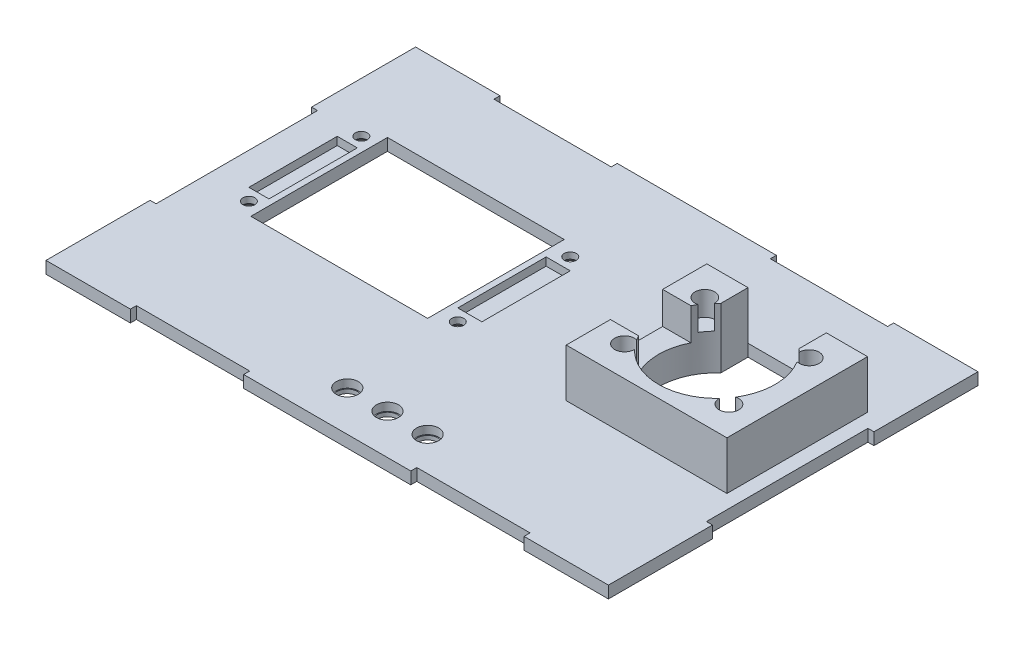
from build123d import *

# Parameters (mm, degrees)
SKETCH1_W                   = 140
SKETCH1_H                   = 92
SKETCH1_R                   = 2.5
SKETCH1_R_2                 = 1.5
SKETCH1_W_2                 = 44
SKETCH1_H_2                 = 34
BOSS_EXTRUDE2_DEPTH         = 3
SKETCH3_W                   = 40
SKETCH3_H                   = 35
SKETCH3_R                   = 14.5
BOSS_EXTRUDE3_DEPTH         = 12
SKETCH5_R                   = 2.45
CUT_EXTRUDE1_DEPTH          = 6
SKETCH6_W                   = 9
SKETCH6_H                   = 13
CUT_EXTRUDE3_DEPTH          = 8
SKETCH8_W                   = 29.2
SKETCH8_H                   = 1.5
SKETCH8_W_2                 = 1.5
SKETCH8_H_2                 = 40.2
SKETCH8_W_3                 = 28.2
CUT_EXTRUDE4_DEPTH          = 107.976632963
SKETCH10_R                  = 14.5
CUT_EXTRUDE5_DEPTH          = 107.976632963
SKETCH11_W                  = 19.5
SKETCH11_H                  = 8
CUT_EXTRUDE6_DEPTH          = 108.354552768
SKETCH12_R                  = 2.75
CUT_EXTRUDE7_DEPTH          = 2
SKETCH13_W                  = 5
SKETCH13_H                  = 22
SKETCH13_W_2                = 6
CUT_EXTRUDE8_DEPTH          = 2
ADVANCEDHOLE1_OUTLINE_R     = 1.7
ADVANCEDHOLE1_OUTLINE_R_2   = 1.5
ADVANCEDHOLE1_DEPTH         = 1.45
ADVANCEDHOLE1_DRAFT         = 45
ADVANCEDHOLE1_2_OUTLINE_R   = 1.7
ADVANCEDHOLE1_2_OUTLINE_R_2 = 1.5
ADVANCEDHOLE1_2_DEPTH       = 1.45
ADVANCEDHOLE1_2_DRAFT       = 45
ADVANCEDHOLE1_3_OUTLINE_R   = 1.7
ADVANCEDHOLE1_3_OUTLINE_R_2 = 1.5
ADVANCEDHOLE1_3_DEPTH       = 1.45
ADVANCEDHOLE1_3_DRAFT       = 45
ADVANCEDHOLE1_4_OUTLINE_R   = 1.7
ADVANCEDHOLE1_4_OUTLINE_R_2 = 1.5
ADVANCEDHOLE1_4_DEPTH       = 1.45
ADVANCEDHOLE1_4_DRAFT       = 45


# Read off the part's stored shape, not the designer's step: AdvancedHole1
with BuildPart() as part:
    # Sketch1 → Boss-Extrude2 (new body)
    with BuildSketch(Plane(origin=(0, 0, 0), x_dir=(1, 0, 0), z_dir=(0, 1, 0))):
        with Locations((0, 34)):
            Rectangle(SKETCH1_W, SKETCH1_H)
        with Locations(Location((-5, -2, 0), (0, 0, 270))):
            Circle(SKETCH1_R, mode=Mode.SUBTRACT)
        with Locations(Location((-57.5, 26, 0), (0, 0, 270))):
            Circle(SKETCH1_R_2, mode=Mode.SUBTRACT)
        with Locations(Location((-5.5, 26, 0), (0, 0, 270))):
            Circle(SKETCH1_R_2, mode=Mode.SUBTRACT)
        with Locations(Location((5, -2, 0), (0, 0, 270))):
            Circle(SKETCH1_R, mode=Mode.SUBTRACT)
        with Locations(Location((15, -2, 0), (0, 0, 270))):
            Circle(SKETCH1_R, mode=Mode.SUBTRACT)
        with Locations((-32, 40)):
            Rectangle(SKETCH1_W_2, SKETCH1_H_2, mode=Mode.SUBTRACT)
        with Locations(Location((-57.5, 54, 0), (0, 0, 270))):
            Circle(SKETCH1_R_2, mode=Mode.SUBTRACT)
        with Locations(Location((-5.5, 54, 0), (0, 0, 270))):
            Circle(SKETCH1_R_2, mode=Mode.SUBTRACT)
        with BuildLine():
            ThreePointArc((33.523109919, 48.017542895), (33.981559973, 48.475723098), (34.306815732, 49.036360451))
            ThreePointArc((34.306815732, 49.036360451), (45, 54), (55.693184268, 49.036360451))
            ThreePointArc((55.693184268, 49.036360451), (56.018440027, 48.475723098), (56.476890081, 48.017542895))
            ThreePointArc((56.476890081, 48.017542895), (45, 26), (33.523109919, 48.017542895))
        make_face(mode=Mode.SUBTRACT)
    extrude(amount=BOSS_EXTRUDE2_DEPTH)

    # Sketch3 → Boss-Extrude3 (add)
    with BuildSketch(Plane(origin=(0, 3, 0), x_dir=(1, 0, 0), z_dir=(0, 1, 0))):
        with Locations((45, 40)):
            Rectangle(SKETCH3_W, SKETCH3_H)
        with Locations(Location((45, 40, 0), (0, 0, 270))):
            Circle(SKETCH3_R, mode=Mode.SUBTRACT)
    extrude(amount=BOSS_EXTRUDE3_DEPTH)

    # Sketch5 → Cut-Extrude1 (cut)
    with BuildSketch(Plane(origin=(0, 15, 0), x_dir=(1, 0, 0), z_dir=(0, 1, 0))):
        with Locations((32, 50)):
            Circle(SKETCH5_R)
        with Locations((58, 50)):
            Circle(SKETCH5_R)
        with Locations((58, 30)):
            Circle(SKETCH5_R)
        with Locations((32, 30)):
            Circle(SKETCH5_R)
    extrude(amount=-CUT_EXTRUDE1_DEPTH, mode=Mode.SUBTRACT)

    # Sketch6 → Cut-Extrude3 (cut)
    with BuildSketch(Plane(origin=(0, 15, 0), x_dir=(1, 0, 0), z_dir=(0, 1, 0))):
        with Locations((29.5, 40)):
            Rectangle(SKETCH6_W, SKETCH6_H)
    extrude(amount=-CUT_EXTRUDE3_DEPTH, mode=Mode.SUBTRACT)

    # Sketch8 → Cut-Extrude4 (cut, through all)
    with BuildSketch(Plane(origin=(0, 3, 0), x_dir=(1, 0, 0), z_dir=(0, 1, 0))):
        with Locations((-34.4, 79.25)):
            Rectangle(SKETCH8_W, SKETCH8_H)
        with Locations((34.4, 79.25)):
            Rectangle(SKETCH8_W, SKETCH8_H)
        with Locations((69.25, 34)):
            Rectangle(SKETCH8_W_2, SKETCH8_H_2)
        with Locations((-69.25, 34)):
            Rectangle(SKETCH8_W_2, SKETCH8_H_2)
        with Locations((-34.9, -11.25)):
            Rectangle(SKETCH8_W_3, SKETCH8_H)
        with Locations((34.9, -11.25)):
            Rectangle(SKETCH8_W_3, SKETCH8_H)
    extrude(amount=-CUT_EXTRUDE4_DEPTH, mode=Mode.SUBTRACT)

    # Sketch10 → Cut-Extrude5 (cut, through all)
    with BuildSketch(Plane(origin=(0, 3, 0), x_dir=(1, 0, 0), z_dir=(0, 1, 0))):
        with Locations(Location((45, 40, 0), (0, 0, 136.687767262))):
            Circle(SKETCH10_R)
    extrude(amount=-CUT_EXTRUDE5_DEPTH, mode=Mode.SUBTRACT)

    # Sketch11 → Cut-Extrude6 (cut, through all)
    with BuildSketch(Plane(origin=(0, 15, 0), x_dir=(1, 0, 0), z_dir=(0, 1, 0))):
        with Locations((45, 53.5)):
            Rectangle(SKETCH11_W, SKETCH11_H)
    extrude(amount=-CUT_EXTRUDE6_DEPTH, mode=Mode.SUBTRACT)

    # Sketch12 → Cut-Extrude7 (cut)
    with BuildSketch(Plane(origin=(0, 3, 0), x_dir=(1, 0, 0), z_dir=(0, 1, 0))):
        with Locations(Location((-5, -2, 0), (0, 0, 270))):
            Circle(SKETCH12_R)
        with Locations(Location((5, -2, 0), (0, 0, 270))):
            Circle(SKETCH12_R)
        with Locations(Location((15, -2, 0), (0, 0, 270))):
            Circle(SKETCH12_R)
    extrude(amount=-CUT_EXTRUDE7_DEPTH, mode=Mode.SUBTRACT)

    # Sketch13 → Cut-Extrude8 (cut)
    with BuildSketch(Plane(origin=(0, 3, 0), x_dir=(1, 0, 0), z_dir=(0, 1, 0))):
        with Locations((-58, 40)):
            Rectangle(SKETCH13_W, SKETCH13_H)
        with Locations((-5.5, 40)):
            Rectangle(SKETCH13_W_2, SKETCH13_H)
    extrude(amount=-CUT_EXTRUDE8_DEPTH, mode=Mode.SUBTRACT)


with BuildPart() as advancedhole1_tool:
    # AdvancedHole1 outline → AdvancedHole1 (with draft: the straight prism first)
    with BuildSketch(Plane(origin=(0, 1.45, 0), x_dir=(1, 0, 0), z_dir=(0, 1, 0))):
        with Locations((-57.5, 54)):
            Circle(ADVANCEDHOLE1_OUTLINE_R)
        with Locations((-57.5, 54)):
            Circle(ADVANCEDHOLE1_OUTLINE_R_2, mode=Mode.SUBTRACT)
    extrude(amount=-ADVANCEDHOLE1_DEPTH)
    # AdvancedHole1: the draft: its side faces are tilted about the plane it starts from
    advancedhole1_sides = [advancedhole1_tool.faces().sort_by_distance(p)[0] for p in [
        (-59.2, 0.725, -54),
        (-59, 0.725, -54),
    ]]
    draft(advancedhole1_sides, Plane(origin=(0, 1.45, 0), x_dir=(1, 0, 0), z_dir=(0, 1, 0)), ADVANCEDHOLE1_DRAFT)


with BuildPart() as part_1:
    add(part.part)

    # AdvancedHole1: cut by advancedhole1_tool
    add(advancedhole1_tool.part, mode=Mode.SUBTRACT)


with BuildPart() as advancedhole1_2_tool:
    # AdvancedHole1 2 outline → AdvancedHole1 2 (with draft: the straight prism first)
    with BuildSketch(Plane(origin=(0, 1.45, 0), x_dir=(1, 0, 0), z_dir=(0, 1, 0))):
        with Locations((-57.5, 26)):
            Circle(ADVANCEDHOLE1_2_OUTLINE_R)
        with Locations((-57.5, 26)):
            Circle(ADVANCEDHOLE1_2_OUTLINE_R_2, mode=Mode.SUBTRACT)
    extrude(amount=-ADVANCEDHOLE1_2_DEPTH)
    # AdvancedHole1 2: the draft: its side faces are tilted about the plane it starts from
    advancedhole1_2_sides = [advancedhole1_2_tool.faces().sort_by_distance(p)[0] for p in [
        (-59.2, 0.725, -26),
        (-59, 0.725, -26),
    ]]
    draft(advancedhole1_2_sides, Plane(origin=(0, 1.45, 0), x_dir=(1, 0, 0), z_dir=(0, 1, 0)), ADVANCEDHOLE1_2_DRAFT)


with BuildPart() as part_2:
    add(part_1.part)

    # AdvancedHole1 2: cut by advancedhole1_2_tool
    add(advancedhole1_2_tool.part, mode=Mode.SUBTRACT)


with BuildPart() as advancedhole1_3_tool:
    # AdvancedHole1 3 outline → AdvancedHole1 3 (with draft: the straight prism first)
    with BuildSketch(Plane(origin=(0, 1.45, 0), x_dir=(1, 0, 0), z_dir=(0, 1, 0))):
        with Locations((-5.5, 26)):
            Circle(ADVANCEDHOLE1_3_OUTLINE_R)
        with Locations((-5.5, 26)):
            Circle(ADVANCEDHOLE1_3_OUTLINE_R_2, mode=Mode.SUBTRACT)
    extrude(amount=-ADVANCEDHOLE1_3_DEPTH)
    # AdvancedHole1 3: the draft: its side faces are tilted about the plane it starts from
    advancedhole1_3_sides = [advancedhole1_3_tool.faces().sort_by_distance(p)[0] for p in [
        (-7.2, 0.725, -26),
        (-7, 0.725, -26),
    ]]
    draft(advancedhole1_3_sides, Plane(origin=(0, 1.45, 0), x_dir=(1, 0, 0), z_dir=(0, 1, 0)), ADVANCEDHOLE1_3_DRAFT)


with BuildPart() as part_3:
    add(part_2.part)

    # AdvancedHole1 3: cut by advancedhole1_3_tool
    add(advancedhole1_3_tool.part, mode=Mode.SUBTRACT)


with BuildPart() as advancedhole1_4_tool:
    # AdvancedHole1 4 outline → AdvancedHole1 4 (with draft: the straight prism first)
    with BuildSketch(Plane(origin=(0, 1.45, 0), x_dir=(1, 0, 0), z_dir=(0, 1, 0))):
        with Locations((-5.5, 54)):
            Circle(ADVANCEDHOLE1_4_OUTLINE_R)
        with Locations((-5.5, 54)):
            Circle(ADVANCEDHOLE1_4_OUTLINE_R_2, mode=Mode.SUBTRACT)
    extrude(amount=-ADVANCEDHOLE1_4_DEPTH)
    # AdvancedHole1 4: the draft: its side faces are tilted about the plane it starts from
    advancedhole1_4_sides = [advancedhole1_4_tool.faces().sort_by_distance(p)[0] for p in [
        (-7.2, 0.725, -54),
        (-7, 0.725, -54),
    ]]
    draft(advancedhole1_4_sides, Plane(origin=(0, 1.45, 0), x_dir=(1, 0, 0), z_dir=(0, 1, 0)), ADVANCEDHOLE1_4_DRAFT)


with BuildPart() as part_4:
    add(part_3.part)

    # AdvancedHole1 4: cut by advancedhole1_4_tool
    add(advancedhole1_4_tool.part, mode=Mode.SUBTRACT)


solid = part_4.part
